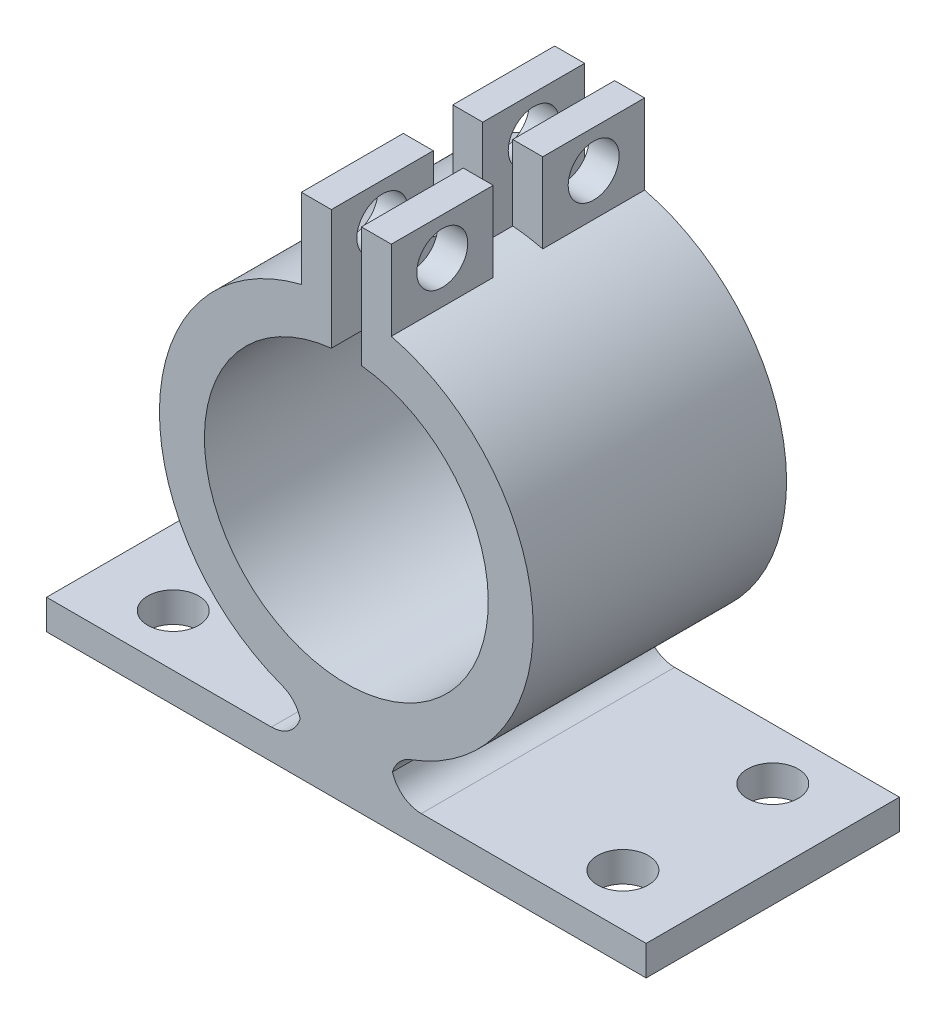
from build123d import *

# Parameters (mm, degrees)
BOSS_EXTRUDE1_DEPTH      = 16.9
SKETCH2_W                = 6.8
SKETCH2_H                = 5
SKETCH2_R                = 1.7
BOSS_EXTRUDE2_DEPTH      = 2
BOSS_EXTRUDE2_2_DEPTH    = 2
BOSS_EXTRUDE3_REACH      = 37.726
BOSS_EXTRUDE3_END_RADIUS = 12.47
SKETCH5_W                = 2
SKETCH5_H                = 6.8
SKETCH7_W                = 6.8
SKETCH7_H                = 5
SKETCH7_R                = 1.7
BOSS_EXTRUDE4_DEPTH      = 2
BOSS_EXTRUDE4_2_DEPTH    = 2
BOSS_EXTRUDE5_REACH      = 37.726
BOSS_EXTRUDE5_END_RADIUS = 12.47
SKETCH8_W                = 2
SKETCH8_H                = 6.8
BOSS_EXTRUDE7_DEPTH      = 17
BOSS_EXTRUDE7_DEPTH_BACK = 23
SKETCH9_W                = 16.9
SKETCH9_H                = 2
CUT_EXTRUDE1_REACH       = 44.835
SKETCH10_R               = 1.7
FILLET1_R                = 2


with BuildPart() as part:
    # Sketch1 → Boss-Extrude1 (new body)
    with BuildSketch(Plane.XY):
        with BuildLine():
            ThreePointArc((9.47, 0), (-6.332886388, -7.040983596), (-1, 9.417053679))
            Line((-1, 9.417053679), (-1, 12.429839098))
            ThreePointArc((-1, 12.429839098), (-12.428769746, 1.01320413), (-3, -12.103755616))
            Line((-3, -12.103755616), (-3, -16.47))
            Line((-3, -16.47), (3, -16.47))
            Line((3, -16.47), (3, -12.103755616))
            ThreePointArc((3, -12.103755616), (12.428769746, 1.01320413), (1, 12.429839098))
            Line((1, 12.429839098), (1, 9.417053679))
            ThreePointArc((1, 9.417053679), (7.040983596, 6.332886388), (9.47, 0))
        make_face()
    extrude(amount=BOSS_EXTRUDE1_DEPTH)



with BuildPart() as body_2:
    # Sketch2 → Boss-Extrude2 (new body)
    with BuildSketch(Plane(origin=(-1, 0, 0), x_dir=(0, 0, -1), z_dir=(1, 0, 0))):
        with Locations((-13.5, 14.929839098)):
            Rectangle(SKETCH2_W, SKETCH2_H)
        with Locations((-13.5, 14.929839098)):
            Circle(SKETCH2_R, mode=Mode.SUBTRACT)
    extrude(amount=-BOSS_EXTRUDE2_DEPTH)


with BuildPart() as body_3:
    # Sketch2 → Boss-Extrude2 2 (new body)
    with BuildSketch(Plane(origin=(-1, 0, 0), x_dir=(0, 0, -1), z_dir=(1, 0, 0))):
        with Locations((-3.4, 14.929839098)):
            Rectangle(SKETCH2_W, SKETCH2_H)
        with Locations(Location((-3.4, 14.929839098, 0), (0, 0, 180))):
            Circle(SKETCH2_R, mode=Mode.SUBTRACT)
    extrude(amount=-BOSS_EXTRUDE2_2_DEPTH)


with BuildPart() as part_1:
    add(part.part)

    add(body_2.part)  # Boss-Extrude3 merges body 2

    add(body_3.part)  # Boss-Extrude3 merges body 3
    # Boss-Extrude3: up to this cylinder (the profile starts outside it)
    boss_extrude3_end = Plane(origin=(0, 0, 8.45), z_dir=(0, 0, -1)) * Cylinder(BOSS_EXTRUDE3_END_RADIUS, 111.492, mode=Mode.PRIVATE)
    # Sketch5 → Boss-Extrude3 (add, up to the surface)
    with BuildSketch(Plane.XZ.offset(-12.429839098), mode=Mode.PRIVATE) as boss_extrude3_sk1:
        with Locations((-2, 3.4)):
            Rectangle(SKETCH5_W, SKETCH5_H)
    boss_extrude3_tool1 = extrude(boss_extrude3_sk1.sketch, amount=BOSS_EXTRUDE3_REACH, mode=Mode.PRIVATE) - boss_extrude3_end
    add(boss_extrude3_tool1.solids().sort_by_distance((-2, 12.429839, 3.4))[0])
    # Sketch5 → Boss-Extrude3 (add, up to the surface)
    with BuildSketch(Plane.XZ.offset(-12.429839098), mode=Mode.PRIVATE) as boss_extrude3_sk2:
        with Locations((-2, 13.5)):
            Rectangle(SKETCH5_W, SKETCH5_H)
    boss_extrude3_tool2 = extrude(boss_extrude3_sk2.sketch, amount=BOSS_EXTRUDE3_REACH, mode=Mode.PRIVATE) - boss_extrude3_end
    add(boss_extrude3_tool2.solids().sort_by_distance((-2, 12.429839, 13.5))[0])



with BuildPart() as body_2_2:
    # Sketch7 → Boss-Extrude4 (new body)
    with BuildSketch(Plane.ZY.offset(-1)):
        with Locations((3.4, 14.929839098)):
            Rectangle(SKETCH7_W, SKETCH7_H)
        with Locations((3.4, 14.929839098)):
            Circle(SKETCH7_R, mode=Mode.SUBTRACT)
    extrude(amount=-BOSS_EXTRUDE4_DEPTH)


with BuildPart() as body_3_2:
    # Sketch7 → Boss-Extrude4 2 (new body)
    with BuildSketch(Plane.ZY.offset(-1)):
        with Locations((13.5, 14.929839098)):
            Rectangle(SKETCH7_W, SKETCH7_H)
        with Locations(Location((13.5, 14.929839098, 0), (0, 0, 180))):
            Circle(SKETCH7_R, mode=Mode.SUBTRACT)
    extrude(amount=-BOSS_EXTRUDE4_2_DEPTH)


with BuildPart() as part_2:
    add(part_1.part)

    add(body_2_2.part)  # Boss-Extrude5 merges body 2 2

    add(body_3_2.part)  # Boss-Extrude5 merges body 3 2
    # Boss-Extrude5: up to this cylinder (the profile starts outside it)
    boss_extrude5_end = Plane(origin=(0, 0, 8.45), z_dir=(0, 0, -1)) * Cylinder(BOSS_EXTRUDE5_END_RADIUS, 111.492, mode=Mode.PRIVATE)
    # Sketch8 → Boss-Extrude5 (add, up to the surface)
    with BuildSketch(Plane.XZ.offset(-12.429839098), mode=Mode.PRIVATE) as boss_extrude5_sk1:
        with Locations((2, 3.4)):
            Rectangle(SKETCH8_W, SKETCH8_H)
    boss_extrude5_tool1 = extrude(boss_extrude5_sk1.sketch, amount=BOSS_EXTRUDE5_REACH, mode=Mode.PRIVATE) - boss_extrude5_end
    add(boss_extrude5_tool1.solids().sort_by_distance((2, 12.429839, 3.4))[0])
    # Sketch8 → Boss-Extrude5 (add, up to the surface)
    with BuildSketch(Plane.XZ.offset(-12.429839098), mode=Mode.PRIVATE) as boss_extrude5_sk2:
        with Locations((2, 13.5)):
            Rectangle(SKETCH8_W, SKETCH8_H)
    boss_extrude5_tool2 = extrude(boss_extrude5_sk2.sketch, amount=BOSS_EXTRUDE5_REACH, mode=Mode.PRIVATE) - boss_extrude5_end
    add(boss_extrude5_tool2.solids().sort_by_distance((2, 12.429839, 13.5))[0])

    # Sketch9 → Boss-Extrude7 (add, two sides: drawn at the far end of the back side and taken through both)
    with BuildSketch(Plane.ZY.offset(3).offset(-BOSS_EXTRUDE7_DEPTH_BACK)):
        with Locations((8.45, -15.47)):
            Rectangle(SKETCH9_W, SKETCH9_H)
    extrude(amount=BOSS_EXTRUDE7_DEPTH + BOSS_EXTRUDE7_DEPTH_BACK)

    # Sketch10 → Cut-Extrude1 (cut, up to next)
    with BuildSketch(Plane.XZ.offset(16.47), mode=Mode.PRIVATE) as cut_extrude1_sk1:
        with Locations(Location((-15, 3.45, 0), (0, 0, 270))):
            Circle(SKETCH10_R)
    cut_extrude1_tool1 = extrude(cut_extrude1_sk1.sketch, amount=-CUT_EXTRUDE1_REACH, mode=Mode.PRIVATE) & part_2.part
    # Sketch10 → Cut-Extrude1 (cut, up to next)
    with BuildSketch(Plane.XZ.offset(16.47), mode=Mode.PRIVATE) as cut_extrude1_sk2:
        with Locations(Location((-15, 13.45, 0), (0, 0, 270))):
            Circle(SKETCH10_R)
    cut_extrude1_tool2 = extrude(cut_extrude1_sk2.sketch, amount=-CUT_EXTRUDE1_REACH, mode=Mode.PRIVATE) & part_2.part
    # Sketch10 → Cut-Extrude1 (cut, up to next)
    with BuildSketch(Plane.XZ.offset(16.47), mode=Mode.PRIVATE) as cut_extrude1_sk3:
        with Locations(Location((15, 3.45, 0), (0, 0, 270))):
            Circle(SKETCH10_R)
    cut_extrude1_tool3 = extrude(cut_extrude1_sk3.sketch, amount=-CUT_EXTRUDE1_REACH, mode=Mode.PRIVATE) & part_2.part
    # Sketch10 → Cut-Extrude1 (cut, up to next)
    with BuildSketch(Plane.XZ.offset(16.47), mode=Mode.PRIVATE) as cut_extrude1_sk4:
        with Locations(Location((15, 13.45, 0), (0, 0, 270))):
            Circle(SKETCH10_R)
    cut_extrude1_tool4 = extrude(cut_extrude1_sk4.sketch, amount=-CUT_EXTRUDE1_REACH, mode=Mode.PRIVATE) & part_2.part
    add(cut_extrude1_tool1.solids().sort_by_distance((-15, -16.47, 3.45))[0], mode=Mode.SUBTRACT)
    add(cut_extrude1_tool2.solids().sort_by_distance((-15, -16.47, 13.45))[0], mode=Mode.SUBTRACT)
    add(cut_extrude1_tool3.solids().sort_by_distance((15, -16.47, 3.45))[0], mode=Mode.SUBTRACT)
    add(cut_extrude1_tool4.solids().sort_by_distance((15, -16.47, 13.45))[0], mode=Mode.SUBTRACT)

    # Fillet1
    # the kernel refuses this fillet: 2 mm, written as the material it adds along each edge
    with BuildSketch(Plane(origin=(-3, -12.103755616, 0), x_dir=(-0.9559582766785055, 0.2935025949627393, 0), z_dir=(0, 0, 1))) as fillet1_piece_1:
        with BuildLine():
            CenterArc((1.479018642, 1.996983664), FILLET1_R, 197.067768115, 69.785084401)
            Line((-0.432897911, 1.409978474), (0, 0))
            ThreePointArc((0, 0), (0.684608852, 0.018806856), (1.369217704, 0))
        make_face()
    extrude(amount=16.9)
    with BuildSketch(Plane(origin=(-3, -14.47, 16.9), x_dir=(0, 1, 0), z_dir=(0, 0, -1))) as fillet1_piece_2:
        with BuildLine():
            CenterArc((FILLET1_R, -FILLET1_R), FILLET1_R, 90, 90)
            Line((0, -FILLET1_R), (0, 0))
            Line((0, 0), (FILLET1_R, 0))
        make_face()
    extrude(amount=16.9)
    with BuildSketch(Plane(origin=(3, -12.103755616, 0), x_dir=(0.9559582766785055, 0.2935025949627393, 0), z_dir=(0, 0, 1))) as fillet1_piece_3:
        with BuildLine():
            CenterArc((1.479018642, -1.996983664), FILLET1_R, 93.147147485, 69.785084401)
            Line((-0.432897911, -1.409978474), (0, 0))
            ThreePointArc((0, 0), (0.684608852, -0.018806856), (1.369217704, 0))
        make_face()
    extrude(amount=16.9)
    with BuildSketch(Plane(origin=(3, -14.47, 0), x_dir=(1, 0, 0), z_dir=(0, 0, 1))) as fillet1_piece_4:
        with BuildLine():
            CenterArc((FILLET1_R, FILLET1_R), FILLET1_R, 180, 90)
            Line((0, FILLET1_R), (0, 0))
            Line((0, 0), (FILLET1_R, 0))
        make_face()
    extrude(amount=16.9)


solid = part_2.part
